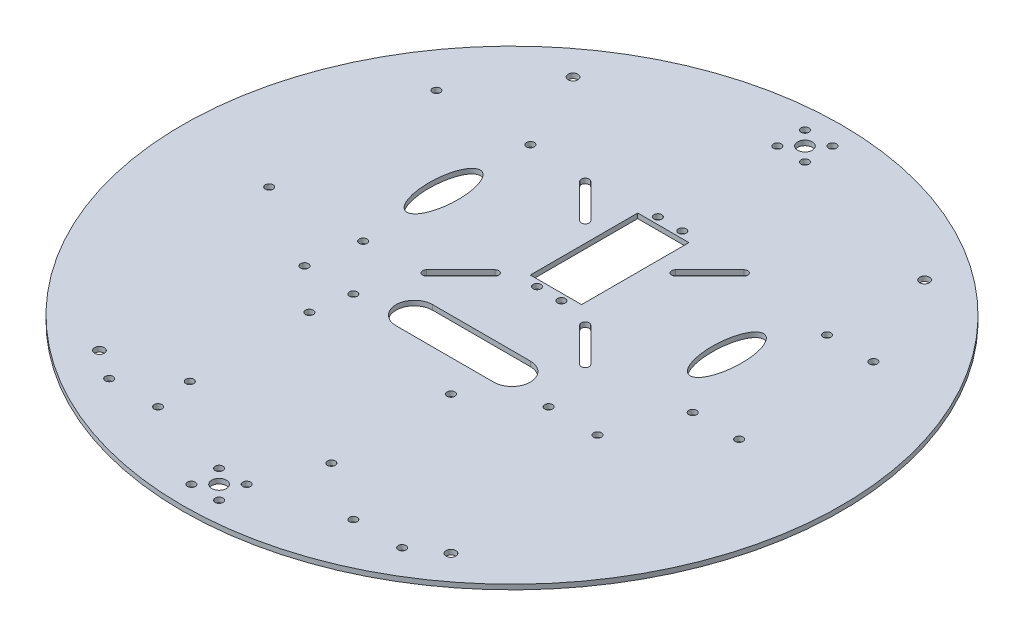
from build123d import *

# Parameters (mm, degrees)
SKETCH_1_R          = 135
EXTRUDE_1_DEPTH     = 2
SKETCH_561_R        = 1.6
SKETCH_561_W        = 21
SKETCH_561_H        = 44
CUT_EXTRUDE_1_DEPTH = 10
SKETCH_1030_R       = 1.6
CUT_EXTRUDE_2_DEPTH = 10
SKETCH_4_R          = 2
SKETCH_4_R_2        = 3
SKETCH_4_R_3        = 1.6
CUT_EXTRUDE_3_DEPTH = 10
CUT_EXTRUDE_4_DEPTH = 10
SKETCH_6_R          = 1.6
SKETCH_6_RX         = 15
SKETCH_6_RY         = 6
CUT_EXTRUDE_7_DEPTH = 10


with BuildPart() as part:
    # 草图1 → 凸台-拉伸1 (new body)
    with BuildSketch(Plane(origin=(0, 0, 0), x_dir=(1, 0, 0), z_dir=(0, 1, 0))):
        Circle(SKETCH_1_R)
    extrude(amount=EXTRUDE_1_DEPTH)

    # Sketch 561 → 切除-拉伸1 (cut)
    with BuildSketch(Plane(origin=(0, 2, 0), x_dir=(1, 0, 0), z_dir=(0, 1, 0))):
        with Locations((-5, 64.75)):
            Circle(SKETCH_561_R)
        with Locations((5, 64.75)):
            Circle(SKETCH_561_R)
        with Locations((-5, 15.25)):
            Circle(SKETCH_561_R)
        with Locations((5, 15.25)):
            Circle(SKETCH_561_R)
        with Locations((18.5, 48.5)):
            Circle(SKETCH_561_R)
        with Locations((18.5, 11.5)):
            Circle(SKETCH_561_R)
        with Locations((-18.5, 11.5)):
            Circle(SKETCH_561_R)
        with Locations((-18.5, 48.5)):
            Circle(SKETCH_561_R)
        with Locations((0, 40)):
            Rectangle(SKETCH_561_W, SKETCH_561_H)
    extrude(amount=-CUT_EXTRUDE_1_DEPTH, mode=Mode.SUBTRACT)

    # Sketch 1030 → 切除-拉伸2 (cut)
    with BuildSketch(Plane(origin=(0, 2, 0), x_dir=(1, 0, 0), z_dir=(0, 1, 0))):
        with Locations((-60, -25)):
            Circle(SKETCH_1030_R)
        with Locations((-40, -25)):
            Circle(SKETCH_1030_R)
        with Locations((40, -25)):
            Circle(SKETCH_1030_R)
        with Locations((60, -25)):
            Circle(SKETCH_1030_R)
        with Locations((60, -105)):
            Circle(SKETCH_1030_R)
        with Locations((40, -105)):
            Circle(SKETCH_1030_R)
        with Locations((-40, -105)):
            Circle(SKETCH_1030_R)
        with Locations((-60, -105)):
            Circle(SKETCH_1030_R)
        with Locations((-42.5, -89.5)):
            Circle(SKETCH_1030_R)
        with Locations((-42.5, -40.5)):
            Circle(SKETCH_1030_R)
        with Locations((15.5, -40.5)):
            Circle(SKETCH_1030_R)
        with Locations((15.5, -89.5)):
            Circle(SKETCH_1030_R)
    extrude(amount=-CUT_EXTRUDE_2_DEPTH, mode=Mode.SUBTRACT)

    # 草图4 → 切除-拉伸3 (cut)
    with BuildSketch(Plane(origin=(0, 2, 0), x_dir=(1, 0, 0), z_dir=(0, 1, 0))):
        with Locations((-72, 97)):
            Circle(SKETCH_4_R)
        with Locations((72, 97)):
            Circle(SKETCH_4_R)
        with Locations((72, -97)):
            Circle(SKETCH_4_R)
        with Locations((-72, -97)):
            Circle(SKETCH_4_R)
        with Locations((0, -120)):
            Circle(SKETCH_4_R_2)
        with Locations((-5.656854249, -125.656854249)):
            Circle(SKETCH_4_R_3)
        with Locations((-5.656854249, -114.343145751)):
            Circle(SKETCH_4_R_3)
        with Locations((5.656854249, -114.343145751)):
            Circle(SKETCH_4_R_3)
        with Locations((5.656854249, -125.656854249)):
            Circle(SKETCH_4_R_3)
        with Locations((5.656854249, 125.656854249)):
            Circle(SKETCH_4_R_3)
        with Locations((5.656854249, 114.343145751)):
            Circle(SKETCH_4_R_3)
        with Locations((-5.656854249, 114.343145751)):
            Circle(SKETCH_4_R_3)
        with Locations((-5.656854249, 125.656854249)):
            Circle(SKETCH_4_R_3)
        with Locations((0, 120)):
            Circle(SKETCH_4_R_2)
        with BuildLine():
            Line((-20, -12.5), (20, -12.5))
            ThreePointArc((20, -12.5), (27.5, -20), (20, -27.5))
            Line((20, -27.5), (-20, -27.5))
            ThreePointArc((-20, -27.5), (-27.5, -20), (-20, -12.5))
        make_face()
    extrude(amount=-CUT_EXTRUDE_3_DEPTH, mode=Mode.SUBTRACT)

    # 草图5 → 切除-拉伸4 (cut)
    with BuildSketch(Plane(origin=(0, 2, 0), x_dir=(1, 0, 0), z_dir=(0, 1, 0))):
        with BuildLine():
            Line((-31.36862915, 63.63137085), (-17.36862915, 49.63137085))
            ThreePointArc((-17.36862915, 49.63137085), (-17.36862915, 47.36862915), (-19.63137085, 47.36862915))
            Line((-19.63137085, 47.36862915), (-33.63137085, 61.36862915))
            ThreePointArc((-33.63137085, 61.36862915), (-33.63137085, 63.63137085), (-31.36862915, 63.63137085))
        make_face()
        with BuildLine():
            Line((33.63137085, 61.36862915), (19.63137085, 47.36862915))
            ThreePointArc((19.63137085, 47.36862915), (17.36862915, 47.36862915), (17.36862915, 49.63137085))
            Line((17.36862915, 49.63137085), (31.36862915, 63.63137085))
            ThreePointArc((31.36862915, 63.63137085), (33.63137085, 63.63137085), (33.63137085, 61.36862915))
        make_face()
        with BuildLine():
            Line((31.36862915, -3.63137085), (17.36862915, 10.36862915))
            ThreePointArc((17.36862915, 10.36862915), (17.36862915, 12.63137085), (19.63137085, 12.63137085))
            Line((19.63137085, 12.63137085), (33.63137085, -1.36862915))
            ThreePointArc((33.63137085, -1.36862915), (33.63137085, -3.63137085), (31.36862915, -3.63137085))
        make_face()
        with BuildLine():
            Line((-33.63137085, -1.36862915), (-19.63137085, 12.63137085))
            ThreePointArc((-19.63137085, 12.63137085), (-17.36862915, 12.63137085), (-17.36862915, 10.36862915))
            Line((-17.36862915, 10.36862915), (-31.36862915, -3.63137085))
            ThreePointArc((-31.36862915, -3.63137085), (-33.63137085, -3.63137085), (-33.63137085, -1.36862915))
        make_face()
    extrude(amount=-CUT_EXTRUDE_4_DEPTH, mode=Mode.SUBTRACT)

    # 草图6 → 切除-拉伸7 (cut)
    with BuildSketch(Plane(origin=(0, 2, 0), x_dir=(1, 0, 0), z_dir=(0, 1, 0))):
        with Locations((71.537199543, 2.5)):
            Circle(SKETCH_6_R)
        with Locations((90.537199543, 2.5)):
            Circle(SKETCH_6_R)
        with Locations((90.537199543, 57.5)):
            Circle(SKETCH_6_R)
        with Locations((71.537199543, 57.5)):
            Circle(SKETCH_6_R)
        with Locations((-95.215957975, -4.25)):
            Circle(SKETCH_6_R)
        with Locations((-56.715957975, -4.25)):
            Circle(SKETCH_6_R)
        with Locations((-95.215957975, 64.25)):
            Circle(SKETCH_6_R)
        with Locations((-56.715957975, 64.25)):
            Circle(SKETCH_6_R)
        with Locations(Location((-58.031053316, 30), (0, 0, -90))):
            Ellipse(SKETCH_6_RX, SKETCH_6_RY)
        with Locations(Location((58.031053316, 30), (0, 0, 90))):
            Ellipse(SKETCH_6_RX, SKETCH_6_RY)
    extrude(amount=-CUT_EXTRUDE_7_DEPTH, mode=Mode.SUBTRACT)


solid = part.part
